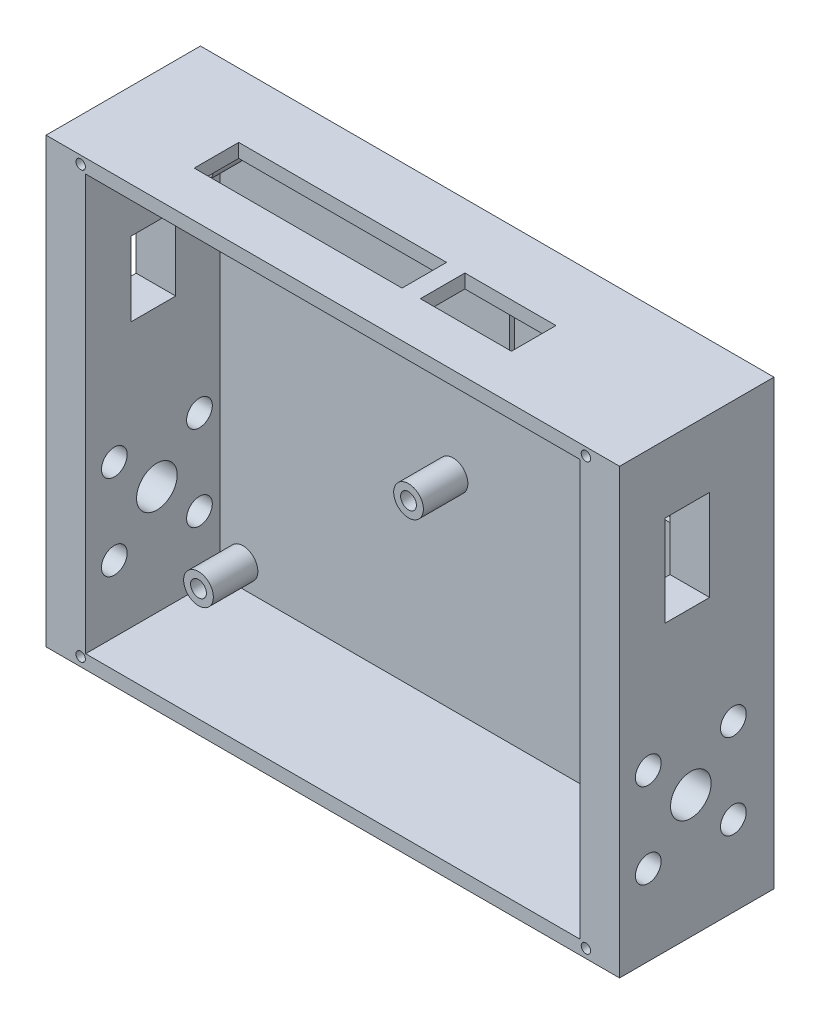
from build123d import *
from build123d.topology import SkipClean

# Parameters (mm, degrees)
EXTRUDE_START             = -4.5
SKETCH_3_W                = 52.75
SKETCH_3_H                = 44.78
EXTRUDE_1_DEPTH           = 2
HOLE_WIZARD_M2_1_D        = 1.6
CUT_EXTRUDE_START         = -2.5
SKETCH_3_5_W              = 9.2
SKETCH_3_5_H              = 7.5
SKETCH_3_5_W_2            = 7.5
SKETCH_3_5_H_2            = 9.2
CUT_EXTRUDE_2_DEPTH       = 0.5
SKETCH_3_6_W              = 52.75
SKETCH_3_6_H              = 44.78
SKETCH_3_6_W_2            = 49.95
SKETCH_3_6_H_2            = 41.98
EXTRUDE_3_DEPTH           = 15.6
SKETCH_10_R               = 1
CUT_EXTRUDE_5_DEPTH       = 70.004774472
SKETCH_13_W               = 4.5
SKETCH_13_H               = 9.2
CUT_EXTRUDE_6_DEPTH       = 2
SKETCH_14_W               = 9.2
SKETCH_14_H               = 4.5
SKETCH_14_W_2             = 21
CUT_EXTRUDE_7_DEPTH       = 2
SKETCH_15_W               = 4.5
SKETCH_15_H               = 7.5
CUT_EXTRUDE_8_DEPTH       = 2
M1_2X0_25_2_D             = 0.95
PCB_4_5_3_M2_1_6_START    = -2.5
SKETCH_23_R               = 1.5
SKETCH_23_R_2             = 0.8
PCB_4_5_3_M2_1_6_DEPTH    = 4.5
SKETCH_26_W               = 15.6
SKETCH_26_H               = 44.78
EXTRUDE_2_6_4_DEPTH       = 2.6
SKETCH_27_W               = 15.6
SKETCH_27_H               = 44.78
EXTRUDE_2_6_4_2_DEPTH     = 2.6
SKETCH_28_R               = 1.3
SKETCH_28_R_2             = 2.05
SKETCH_28_W               = 4.5
SKETCH_28_H               = 7.5
SMA_4X2_6_4_1_USB_DEPTH   = 4
SMA_4X2_6_4_1_USB_START   = -4
SKETCH_29_R               = 1.3
SKETCH_29_R_2             = 2.05
SKETCH_29_W               = 4.5
SKETCH_29_H               = 9.2
SMA_4X2_6_4_1_USB_2_DEPTH = 4


with BuildPart() as part:
    # 草图3 → 凸台-拉伸1 (new body)
    with BuildSketch(Plane.XY.offset(EXTRUDE_START)):
        with Locations((24.675, 20.69)):
            Rectangle(SKETCH_3_W, SKETCH_3_H)
    extrude(amount=EXTRUDE_1_DEPTH)

    # M2 螺纹孔1 (through all)
    with Locations(Plane(origin=(2.003, 2, -2.5), x_dir=(1, 0, 0), z_dir=(0, 0, 1))):
        with Locations((0, 0), (45.447, 0), (45.447, 37.357), (0, 37.357), (21.222, 18.3)):
            Hole(HOLE_WIZARD_M2_1_D / 2)

    # 草图3<5> → 切除-拉伸2 (cut)
    with BuildSketch(Plane.XY.offset(CUT_EXTRUDE_START)):
        with Locations((33.523, 37.63)):
            Rectangle(SKETCH_3_5_W, SKETCH_3_5_H)
        with Locations((45.6, 31.7)):
            Rectangle(SKETCH_3_5_W_2, SKETCH_3_5_H_2)
    extrude(amount=-CUT_EXTRUDE_2_DEPTH, mode=Mode.SUBTRACT)

    # 草图3<6> → 凸台-拉伸3 (add)
    with BuildSketch(Plane.XY.offset(EXTRUDE_START)):
        with Locations((24.675, 20.69)):
            Rectangle(SKETCH_3_6_W, SKETCH_3_6_H)
        with Locations((24.675, 20.69)):
            Rectangle(SKETCH_3_6_W_2, SKETCH_3_6_H_2, mode=Mode.SUBTRACT)
    extrude(amount=EXTRUDE_3_DEPTH)

    # 草图10 → 切除-拉伸5 (cut, through all)
    with BuildSketch(Plane.ZY.offset(1.7)):
        with Locations((3.3, 10.725)):
            Circle(SKETCH_10_R)
    extrude(amount=-CUT_EXTRUDE_5_DEPTH, mode=Mode.SUBTRACT)

    # 草图13 → 切除-拉伸6 (cut)
    with BuildSketch(Plane(origin=(51.05, 0, 0), x_dir=(0, 0, -1), z_dir=(1, 0, 0))):
        with Locations((-4.25, 31.65)):
            Rectangle(SKETCH_13_W, SKETCH_13_H)
    extrude(amount=-CUT_EXTRUDE_6_DEPTH, mode=Mode.SUBTRACT)

    # 草图14 → 切除-拉伸7 (cut)
    with BuildSketch(Plane(origin=(0, 43.08, 0), x_dir=(1, 0, 0), z_dir=(0, 1, 0))):
        with Locations((33.523, -4.25)):
            Rectangle(SKETCH_14_W, SKETCH_14_H)
        with Locations((16.57, -4.25)):
            Rectangle(SKETCH_14_W_2, SKETCH_14_H)
    extrude(amount=-CUT_EXTRUDE_7_DEPTH, mode=Mode.SUBTRACT)

    # 草图15 → 切除-拉伸8 (cut)
    with BuildSketch(Plane.ZY.offset(1.7)):
        with Locations((4.25, 30.2)):
            Rectangle(SKETCH_15_W, SKETCH_15_H)
    extrude(amount=-CUT_EXTRUDE_8_DEPTH, mode=Mode.SUBTRACT)

    # M1.2x0.25 螺纹孔2 (through all)
    with Locations(Plane(origin=(-0.8, -0.8, 11.1), x_dir=(1, 0, 0), z_dir=(0, 0, 1))):
        with Locations((0, 0), (51.05, 0), (51.05, 43.08), (0, 43.08)):
            Hole(M1_2X0_25_2_D / 2)

    # 草图23 → 保持PCB原高度的五处支撑柱_高4.5_外径3_M2底孔1.6 (add)
    # profile 1 of 5: a face of its own
    with SkipClean():  # the faces are left unmerged after this step: merging them gives an invalid solid
        with BuildSketch(Plane.XY.offset(PCB_4_5_3_M2_1_6_START)):
            with Locations(Location((23.225, 20.3, 0), (0, 0, 180))):
                Circle(SKETCH_23_R)
            with Locations((23.225, 20.3)):
                Circle(SKETCH_23_R_2, mode=Mode.SUBTRACT)
        # profile 2 of 5: a face of its own
        with BuildSketch(Plane.XY.offset(PCB_4_5_3_M2_1_6_START)):
            with Locations(Location((2.003, 39.357, 0), (0, 0, 180))):
                Circle(SKETCH_23_R)
            with Locations((2.003, 39.357)):
                Circle(SKETCH_23_R_2, mode=Mode.SUBTRACT)
        # profile 3 of 5: a face of its own
        with BuildSketch(Plane.XY.offset(PCB_4_5_3_M2_1_6_START)):
            with Locations(Location((47.45, 39.357, 0), (0, 0, 180))):
                Circle(SKETCH_23_R)
            with Locations((47.45, 39.357)):
                Circle(SKETCH_23_R_2, mode=Mode.SUBTRACT)
        # profile 4 of 5: a face of its own
        with BuildSketch(Plane.XY.offset(PCB_4_5_3_M2_1_6_START)):
            with Locations(Location((47.45, 2, 0), (0, 0, 180))):
                Circle(SKETCH_23_R)
            with Locations((47.45, 2)):
                Circle(SKETCH_23_R_2, mode=Mode.SUBTRACT)
        # profile 5 of 5: a face of its own
        with BuildSketch(Plane.XY.offset(PCB_4_5_3_M2_1_6_START)):
            with Locations(Location((2.003, 2, 0), (0, 0, 180))):
                Circle(SKETCH_23_R)
            with Locations((2.003, 2)):
                Circle(SKETCH_23_R_2, mode=Mode.SUBTRACT)
        extrude(amount=PCB_4_5_3_M2_1_6_DEPTH)
    add(part.part.scale(1), mode=Mode.REPLACE)  # the faces are merged on a copy

    # 草图26 → Extrude 2.6__4 (add)
    with BuildSketch(Plane.ZY.offset(1.7)):
        with Locations((3.3, 20.69)):
            Rectangle(SKETCH_26_W, SKETCH_26_H)
    extrude(amount=EXTRUDE_2_6_4_DEPTH)

    # 草图27 → Extrude 2.6__4 2 (add)
    with BuildSketch(Plane(origin=(51.05, 0, 0), x_dir=(0, 0, -1), z_dir=(1, 0, 0))):
        with Locations((-3.3, 20.69)):
            Rectangle(SKETCH_27_W, SKETCH_27_H)
    extrude(amount=EXTRUDE_2_6_4_2_DEPTH)

    # 草图28 → SMA__4x2.6__4.1__USB (cut)
    with BuildSketch(Plane.ZY.offset(4.3)):
        with Locations((-0.400503673, 6.425)):
            Circle(SKETCH_28_R)
        with Locations((8.199496327, 6.425)):
            Circle(SKETCH_28_R)
        with Locations((-0.400503673, 15.025)):
            Circle(SKETCH_28_R)
        with Locations((8.199496327, 15.025)):
            Circle(SKETCH_28_R)
        with Locations((3.899496327, 10.725)):
            Circle(SKETCH_28_R_2)
        with Locations((4.25, 30.2)):
            Rectangle(SKETCH_28_W, SKETCH_28_H)
    extrude(amount=-SMA_4X2_6_4_1_USB_DEPTH, mode=Mode.SUBTRACT)

    # 草图29 → SMA__4x2.6__4.1__USB 2 (cut)
    with SkipClean():  # the faces are left unmerged after this step: merging them gives an invalid solid
        with BuildSketch(Plane(origin=(53.65, 0, 0), x_dir=(0, 0, -1), z_dir=(1, 0, 0)).offset(SMA_4X2_6_4_1_USB_START)):
            with Locations(Location((0.400503673, 6.425, 0), (0, 0, 180))):
                Circle(SKETCH_29_R)
            with Locations(Location((-8.199496327, 6.425, 0), (0, 0, 180))):
                Circle(SKETCH_29_R)
            with Locations(Location((0.400503673, 15.025, 0), (0, 0, 180))):
                Circle(SKETCH_29_R)
            with Locations(Location((-8.199496327, 15.025, 0), (0, 0, 180))):
                Circle(SKETCH_29_R)
            with Locations(Location((-3.899496327, 10.725, 0), (0, 0, 180))):
                Circle(SKETCH_29_R_2)
            with Locations((-4.25, 31.65)):
                Rectangle(SKETCH_29_W, SKETCH_29_H)
        extrude(amount=SMA_4X2_6_4_1_USB_2_DEPTH, mode=Mode.SUBTRACT)


solid = part.part
